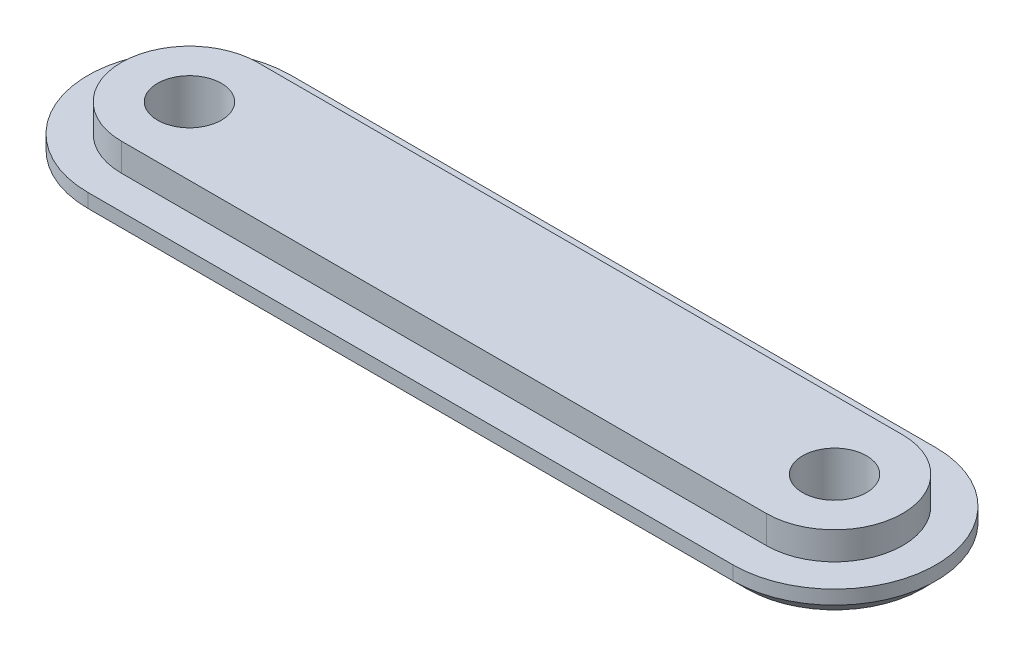
from build123d import *

# Parameters (mm, degrees)
BOSS_EXTRUDE1_DEPTH = 1
BOSS_EXTRUDE2_DEPTH = 1
SKETCH4_R           = 1.15
CUT_EXTRUDE1_DEPTH  = 16.807751263
CHAMFER1_SIZE       = 0.5


with BuildPart() as part:
    # Sketch2 → Boss-Extrude1 (new body)
    with BuildSketch(Plane(origin=(0, 0, 0), x_dir=(1, 0, 0), z_dir=(0, 1, 0))):
        with BuildLine():
            Line((11.6, 3.65), (-11.6, 3.65))
            ThreePointArc((-11.6, 3.65), (-15.25, 0), (-11.6, -3.65))
            Line((-11.6, -3.65), (11.6, -3.65))
            ThreePointArc((11.6, -3.65), (15.25, 0), (11.6, 3.65))
        make_face()
    extrude(amount=-BOSS_EXTRUDE1_DEPTH)

    # Sketch3 → Boss-Extrude2 (add)
    with BuildSketch(Plane(origin=(0, 0, 0), x_dir=(1, 0, 0), z_dir=(0, 1, 0))):
        with BuildLine():
            Line((-11.6, -2.45), (11.6, -2.45))
            ThreePointArc((11.6, -2.45), (14.05, 0), (11.6, 2.45))
            Line((11.6, 2.45), (-11.6, 2.45))
            ThreePointArc((-11.6, 2.45), (-14.05, 0), (-11.6, -2.45))
        make_face()
    extrude(amount=BOSS_EXTRUDE2_DEPTH)

    # Sketch4 → Cut-Extrude1 (cut, through all)
    with BuildSketch(Plane(origin=(0, 1, 0), x_dir=(1, 0, 0), z_dir=(0, 1, 0))):
        with Locations((-11.6, 0)):
            Circle(SKETCH4_R)
        with Locations((11.6, 0)):
            Circle(SKETCH4_R)
    extrude(amount=-CUT_EXTRUDE1_DEPTH, mode=Mode.SUBTRACT)

    # Chamfer1
    chamfer1_edges = [part.edges().sort_by_distance(p)[0] for p in [
        (0, -1, -3.65),
        (-15.25, -1, 0),
        (15.25, -1, 0),
        (0, -1, 3.65),
    ]]
    chamfer(chamfer1_edges, length=CHAMFER1_SIZE)


solid = part.part
